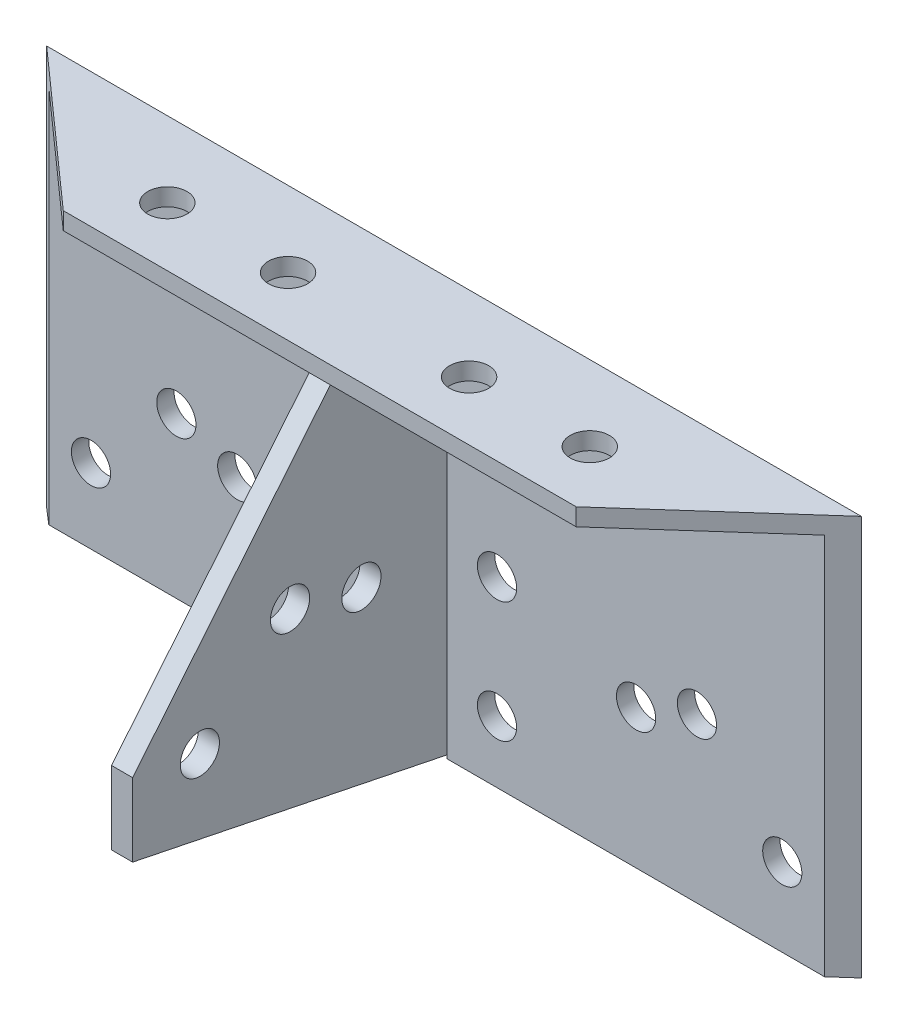
from build123d import *

# Parameters (mm, degrees)
SKETCH_1_W          = 540
SKETCH_1_H          = 265
SKETCH_1_R          = 13
EXTRUDE_613_DEPTH   = 11.5
SKETCH_2_W          = 540
SKETCH_2_H          = 11.5
EXTRUDE_1_DEPTH     = 77.5
CUT_EXTRUDE_1_DEPTH = 609.067430471
SKETCH_4_R          = 13
CUT_EXTRUDE_2_DEPTH = 609.067430471
SKETCH_5_W          = 14
SKETCH_5_H          = 253.5
EXTRUDE_2_DEPTH     = 208.5
SKETCH_6_R          = 13
CUT_EXTRUDE_3_DEPTH = 442.988687638


with BuildPart() as part:
    # 草图1 → Extrude 613 (new body)
    with BuildSketch(Plane.XY):
        with Locations((270, 132.5)):
            Rectangle(SKETCH_1_W, SKETCH_1_H)
        with Locations((97.46594539, 108.46594539)):
            Circle(SKETCH_1_R, mode=Mode.SUBTRACT)
        with Locations((40.897402896, 51.897402896)):
            Circle(SKETCH_1_R, mode=Mode.SUBTRACT)
        with Locations((499.102597104, 51.897402896)):
            Circle(SKETCH_1_R, mode=Mode.SUBTRACT)
        with Locations((402.170987639, 92.261534081)):
            Circle(SKETCH_1_R, mode=Mode.SUBTRACT)
        with Locations((230, 121)):
            Circle(SKETCH_1_R, mode=Mode.SUBTRACT)
        with Locations((230, 41)):
            Circle(SKETCH_1_R, mode=Mode.SUBTRACT)
        with Locations((310, 41)):
            Circle(SKETCH_1_R, mode=Mode.SUBTRACT)
        with Locations((310, 121)):
            Circle(SKETCH_1_R, mode=Mode.SUBTRACT)
        with Locations((137.829012361, 92.261534081)):
            Circle(SKETCH_1_R, mode=Mode.SUBTRACT)
        with Locations((442.53405461, 108.46594539)):
            Circle(SKETCH_1_R, mode=Mode.SUBTRACT)
    extrude(amount=EXTRUDE_613_DEPTH)

    # 草图2 → 凸台-拉伸1 (add)
    with BuildSketch(Plane.XY.offset(11.5)):
        with Locations((270, 259.25)):
            Rectangle(SKETCH_2_W, SKETCH_2_H)
    extrude(amount=EXTRUDE_1_DEPTH)

    # 草图3 → 切除-拉伸1 (cut, through all)
    with BuildSketch(Plane(origin=(0, 265, 0), x_dir=(-1, 0, 0), z_dir=(0, 1, 0))):
        Polygon((0, 0), (-100, 89), (0, 89), align=None)
        Polygon((-540, 0), (-440, 89), (-540, 89), align=None)
    extrude(amount=-CUT_EXTRUDE_1_DEPTH, mode=Mode.SUBTRACT)

    # 草图4 → 切除-拉伸2 (cut, through all)
    with BuildSketch(Plane(origin=(0, 265, 0), x_dir=(-1, 0, 0), z_dir=(0, 1, 0))):
        with Locations((-210, 50)):
            Circle(SKETCH_4_R)
        with Locations((-130, 50)):
            Circle(SKETCH_4_R)
        with Locations((-410, 50)):
            Circle(SKETCH_4_R)
        with Locations((-330, 50)):
            Circle(SKETCH_4_R)
    extrude(amount=-CUT_EXTRUDE_2_DEPTH, mode=Mode.SUBTRACT)

    # 草图5 → 凸台-拉伸2 (add)
    with BuildSketch(Plane.XY.offset(11.5)):
        with Locations((270, 126.75)):
            Rectangle(SKETCH_5_W, SKETCH_5_H)
    extrude(amount=EXTRUDE_2_DEPTH)

    # 草图6 → 切除-拉伸3 (cut, through all)
    with BuildSketch(Plane(origin=(277, 0, 0), x_dir=(0, 0, -1), z_dir=(1, 0, 0))):
        with Locations((-115.676148082, 138.142814541)):
            Circle(SKETCH_6_R)
        with Locations((-175.462621788, 84.986652509)):
            Circle(SKETCH_6_R)
        with Locations((-68.377294113, 126.911974174)):
            Circle(SKETCH_6_R)
        Polygon((-89, 253.5), (-220, 93.5), (-220, 253.5), align=None)
        Polygon((-220, 45), (0, 0), (-220, 0), align=None)
    extrude(amount=-CUT_EXTRUDE_3_DEPTH, mode=Mode.SUBTRACT)


solid = part.part
